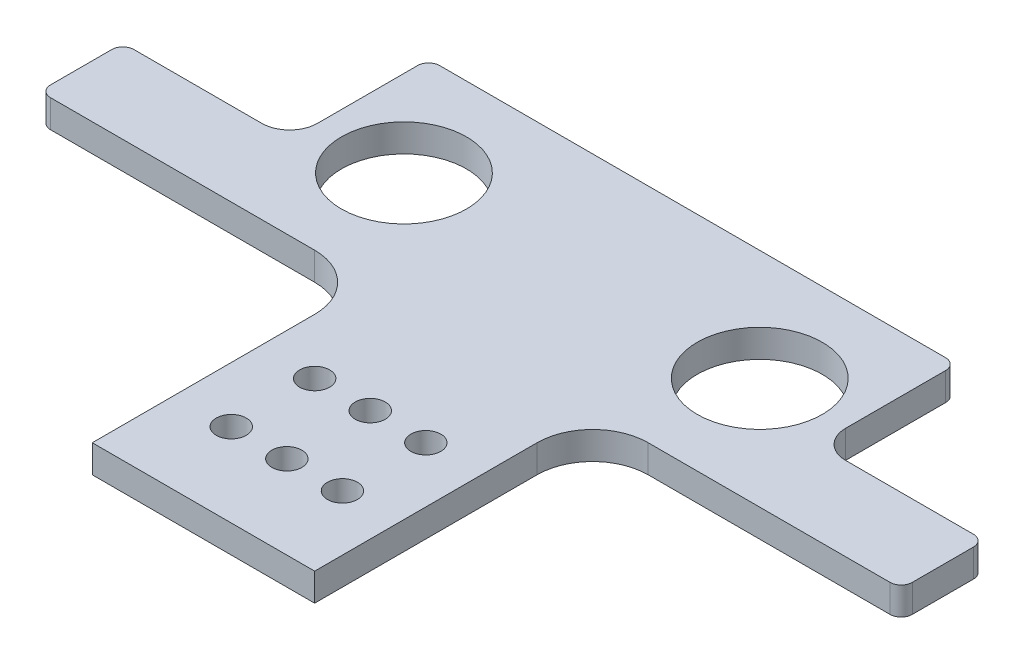
from build123d import *

# Parameters (mm, degrees)
SKETCH2_W            = 120.65
SKETCH2_H            = 50.8
BOSS_EXTRUDE1_DEPTH  = 6.35
SKETCH3_R            = 14.2875
CUT_EXTRUDE1_DEPTH   = 6.35
SKETCH6_W            = 38.1
SKETCH6_H            = 19.05
BOSS_EXTRUDE2_DEPTH  = 6.35
FILLET2_R            = 6.35
FILLET1_R            = 2.54
SKETCH8_W            = 50.8
SKETCH8_H            = 63.5
BOSS_EXTRUDE3_DEPTH  = 6.35
FILLET3_R            = 12.7
SKETCH9_R            = 3.429
CUT_EXTRUDE2_DEPTH   = 6.35
LPATTERN1_COUNT      = 3
LPATTERN1_PITCH      = 12.7
LPATTERN1_COUNT_DIR2 = 2
LPATTERN1_PITCH_DIR2 = 19.05


with BuildPart() as part:
    # Sketch2 → Boss-Extrude1 (new body)
    with BuildSketch(Plane(origin=(0, 0, 0), x_dir=(1, 0, 0), z_dir=(0, 1, 0))):
        with Locations((7.924270833, 15.531041667)):
            Rectangle(SKETCH2_W, SKETCH2_H)
    extrude(amount=BOSS_EXTRUDE1_DEPTH)

    # Sketch3 → Cut-Extrude1 (cut)
    with BuildSketch(Plane(origin=(0, 6.35, 0), x_dir=(1, 0, 0), z_dir=(0, 1, 0))):
        with Locations((-32.715729167, 15.61478805)):
            Circle(SKETCH3_R)
    cut_extrude1 = extrude(amount=-CUT_EXTRUDE1_DEPTH, mode=Mode.SUBTRACT)

    # Mirror1: Cut-Extrude1 across plane
    add(cut_extrude1.mirror(Plane(origin=(7.924270833, 0, 0), x_dir=(0, 0, 1), z_dir=(1, 0, 0))), mode=Mode.SUBTRACT)

    # Sketch6 → Boss-Extrude2 (add)
    with BuildSketch(Plane(origin=(0, 6.35, 0), x_dir=(1, 0, 0), z_dir=(0, 1, 0))):
        with Locations((-71.450729167, -0.343958333)):
            Rectangle(SKETCH6_W, SKETCH6_H)
    boss_extrude2 = extrude(amount=-BOSS_EXTRUDE2_DEPTH)

    # Mirror2: Boss-Extrude2 across plane
    add(boss_extrude2.mirror(Plane(origin=(7.924270833, 0, 0), x_dir=(0, 0, 1), z_dir=(1, 0, 0))))

    # Fillet2
    fillet2_edges = [part.edges().sort_by_distance(p)[0] for p in [
        (68.249270833, 3.175, -9.181041667),
        (-52.400729167, 3.175, -9.181041667),
    ]]
    fillet(fillet2_edges, radius=FILLET2_R)

    # Fillet1
    fillet1_edges = [part.edges().sort_by_distance(p)[0] for p in [
        (68.249270833, 3.175, -40.931041667),
        (-52.400729167, 3.175, -40.931041667),
        (106.349270833, 3.175, 9.868958333),
        (106.349270833, 3.175, -9.181041667),
        (-90.500729167, 3.175, 9.868958333),
        (-90.500729167, 3.175, -9.181041667),
    ]]
    fillet(fillet1_edges, radius=FILLET1_R)

    # Sketch8 → Boss-Extrude3 (add)
    with BuildSketch(Plane(origin=(0, 6.35, 0), x_dir=(1, 0, 0), z_dir=(0, 1, 0))):
        with Locations((10.464270833, -41.618958333)):
            Rectangle(SKETCH8_W, SKETCH8_H)
    extrude(amount=-BOSS_EXTRUDE3_DEPTH)

    # Fillet3
    fillet3_edges = [part.edges().sort_by_distance(p)[0] for p in [
        (35.864270833, 3.175, 9.868958333),
        (-14.935729167, 3.175, 9.868958333),
    ]]
    fillet(fillet3_edges, radius=FILLET3_R)

    # Sketch9 → Cut-Extrude2 (cut)
    with BuildSketch(Plane(origin=(0, 6.35, 0), x_dir=(1, 0, 0), z_dir=(0, 1, 0))):
        with Locations((-2.235729167, -54.318958333)):
            Circle(SKETCH9_R)
    cut_extrude2 = extrude(amount=-CUT_EXTRUDE2_DEPTH, mode=Mode.SUBTRACT)

    # LPattern1: Cut-Extrude2 3 × 2
    with Locations(*[(i * LPATTERN1_PITCH, 0, -j * LPATTERN1_PITCH_DIR2) for i in range(LPATTERN1_COUNT) for j in range(LPATTERN1_COUNT_DIR2) if (i, j) != (0, 0)]):
        add(cut_extrude2, mode=Mode.SUBTRACT)


solid = part.part
